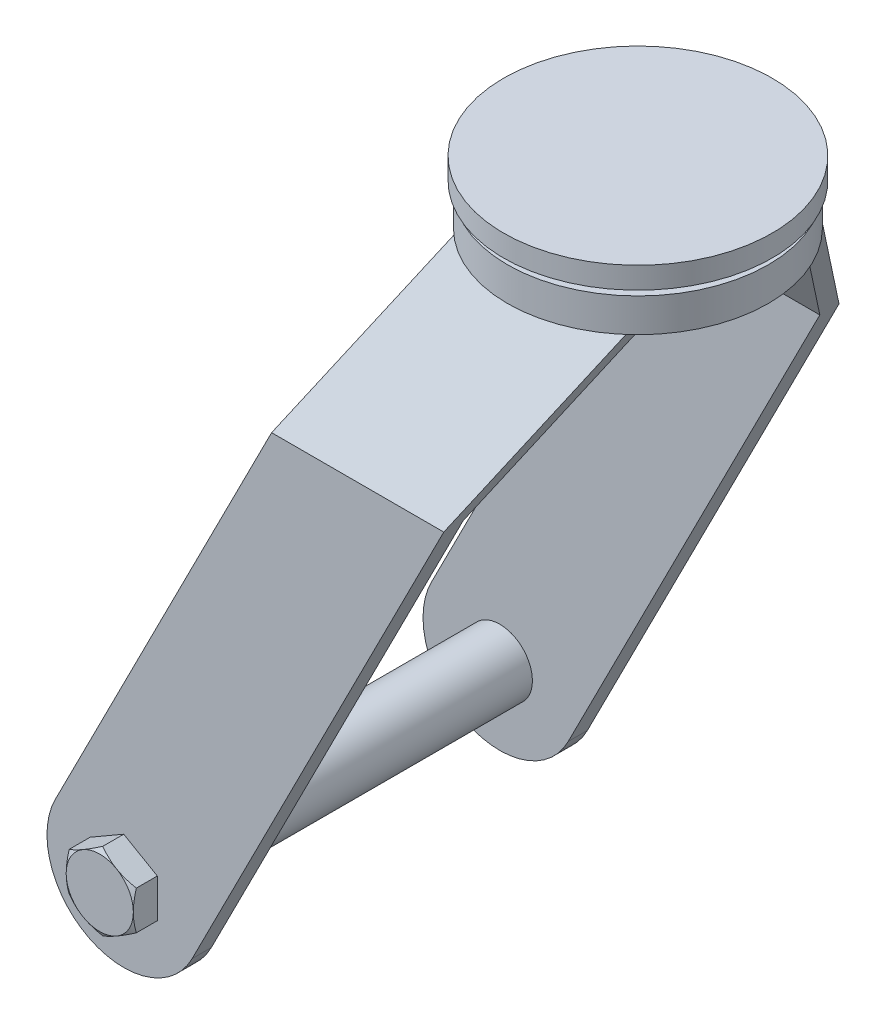
from build123d import *

# Parameters (mm, degrees)
SKETCH7_W               = 285.665653371
SKETCH7_H               = 130.81
BOSS_EXTRUDE2_DEPTH     = 358.6099
CUT_EXTRUDE1_START      = -130.81
CUT_EXTRUDE1_DEPTH      = 130.81
CUT_EXTRUDE3_DEPTH      = 201.637469042
CUT_EXTRUDE3_DEPTH_BACK = 201.637469042
SKETCH9_OUTSIDE_W       = 199.538
SKETCH9_OUTSIDE_H       = 321.141
BOSS_EXTRUDE3_DEPTH     = 7.9375
SKETCH11_OUTSIDE_W      = 1360.045
SKETCH11_OUTSIDE_H      = 1437.832
SKETCH11_OUTSIDE_R      = 11.1125
CUT_EXTRUDE4_DEPTH      = 322.176634871
CUT_EXTRUDE4_DRAFT      = -60
SKETCH12_R              = 10.795
BOSS_EXTRUDE4_DEPTH     = 118.11


# Read off the part's stored shape, not the designer's step: Cut-Extrude1
with BuildPart() as part:
    # Sketch4 → Revolve1 (revolve)
    with BuildSketch(Plane.XY, mode=Mode.PRIVATE) as revolve1_sk:
        Polygon((0, -27.1526), (43.18, -27.1526), (43.18, -16.0401), (40.64, -16.0401), (40.64, -13.5001), (44.45, -13.5001), (44.45, -6.35), (0, -6.35), align=None)
    revolve(revolve1_sk.sketch.rotate(Axis((0, -6.35, 0), (0, -1, 0)), 180), axis=Axis((0, -6.35, 0), (0, -1, 0)))


with BuildPart() as body_2:
    # Sketch7 → Boss-Extrude2 (new body)
    with BuildSketch(Plane.XZ.offset(27.1526)):
        with Locations((-114.342173315, 0)):
            Rectangle(SKETCH7_W, SKETCH7_H)
    extrude(amount=BOSS_EXTRUDE2_DEPTH)

    # Cut-Extrude1 outline → Cut-Extrude1 (cut)
    with BuildSketch(Plane.XY.offset(65.405).offset(CUT_EXTRUDE1_START)):
        with BuildLine():
            Line((28.490653371, -27.1526), (-82.130380672, -244.868203606))
            ThreePointArc((-82.130380672, -244.868203606), (-116.280703606, -256.007119328), (-127.419619328, -221.856796394))
            Line((-127.419619328, -221.856796394), (-28.490653371, -27.1526))
            Line((-28.490653371, -27.1526), (-257.175, -27.1526))
            Line((-257.175, -27.1526), (-257.175, -385.7625))
            Line((-257.175, -385.7625), (28.490653371, -385.7625))
            Line((28.490653371, -385.7625), (28.490653371, -27.1526))
        make_face()
    extrude(amount=CUT_EXTRUDE1_DEPTH, mode=Mode.SUBTRACT)

    # Sketch9 outside → Cut-Extrude3 (cut, two sides: drawn at the far end of the back side and taken through both)
    with BuildSketch(Plane(origin=(0, -144.306693689, 0), x_dir=(0, 0, -1), z_dir=(-1, 0, 0)).offset(-CUT_EXTRUDE3_DEPTH_BACK)):
        with Locations((0, -11.7505)):
            Rectangle(SKETCH9_OUTSIDE_W, SKETCH9_OUTSIDE_H)
        Polygon((65.405, 241.455806311), (65.405, -63.344193689), (32.446803702, -117.154093689), (26.096803702, -117.154093689), (59.055, -63.344193689), (59.055, 241.455806311), align=None, mode=Mode.SUBTRACT)
        Polygon((-26.096803702, -117.154093689), (-32.446803702, -117.154093689), (-65.405, -63.344193689), (-65.405, 241.455806311), (-59.055, 241.455806311), (-59.055, -63.344193689), align=None, mode=Mode.SUBTRACT)
    extrude(amount=CUT_EXTRUDE3_DEPTH + CUT_EXTRUDE3_DEPTH_BACK, mode=Mode.SUBTRACT)


with BuildPart() as cut_extrude3_piece_1:
    # of the separate pieces the step leaves, piece 1, a body of its own (cut_extrude3_pieces_kept)
    add(body_2.part.solids().sort_by_distance((28.490653371, -27.1526, -32.446803702))[0])



with BuildPart() as cut_extrude3_piece_2:
    # of the separate pieces the step leaves, piece 2, a body of its own (cut_extrude3_pieces_kept)
    add(body_2.part.solids().sort_by_distance((-82.130380672, -244.868203606, 65.405))[0])


with BuildPart() as body_4:
    # Sketch10 → Boss-Extrude3 (new body)
    with BuildSketch(Plane.XY.offset(65.405)):
        Polygon((-104.775, -220.530890267), (-115.8875, -226.946695134), (-115.8875, -239.778304866), (-104.775, -246.194109733), (-93.6625, -239.778304866), (-93.6625, -226.946695134), align=None)
    extrude(amount=BOSS_EXTRUDE3_DEPTH)


with BuildPart() as cut_extrude4_tool:
    # Sketch11 outside → Cut-Extrude4 (with draft: the straight prism first)
    with BuildSketch(Plane.XY.offset(73.3425)):
        with Locations((-42.8625, -132.556)):
            Rectangle(SKETCH11_OUTSIDE_W, SKETCH11_OUTSIDE_H)
        with Locations((-104.775, -233.3625)):
            Circle(SKETCH11_OUTSIDE_R, mode=Mode.SUBTRACT)
    extrude(amount=-CUT_EXTRUDE4_DEPTH)
    # Cut-Extrude4: the draft: its side faces are tilted about the plane it starts from
    cut_extrude4_sides = [cut_extrude4_tool.faces().sort_by_distance(p)[0] for p in [
        (-42.8625, -851.472, -87.745817436),
        (637.16, -132.556, -87.745817436),
        (-42.8625, 586.36, -87.745817436),
        (-722.885, -132.556, -87.745817436),
        (-115.8875, -233.3625, -87.745817436),
    ]]
    draft(cut_extrude4_sides, Plane.XY.offset(73.3425), CUT_EXTRUDE4_DRAFT)


with BuildPart() as body_4_1:
    add(body_4.part)

    # Cut-Extrude4: cut by cut_extrude4_tool
    add(cut_extrude4_tool.part, mode=Mode.SUBTRACT)


with BuildPart() as body_5:
    # Mirror1: mirrored copy
    add(body_4_1.part.mirror(Plane.XY))


with BuildPart() as cut_extrude3_piece_1_1:
    add(cut_extrude3_piece_1.part)

    add(cut_extrude3_piece_2.part)  # Boss-Extrude4 merges Cut-Extrude3 piece 2
    # Sketch12 → Boss-Extrude4 (add)
    with BuildSketch(Plane.XY.offset(-59.055)):
        with Locations(Location((-104.775, -233.3625, 0), (0, 0, 180))):
            Circle(SKETCH12_R)
    extrude(amount=BOSS_EXTRUDE4_DEPTH)


solid = Compound([part.part, body_4_1.part, body_5.part, cut_extrude3_piece_1_1.part])
